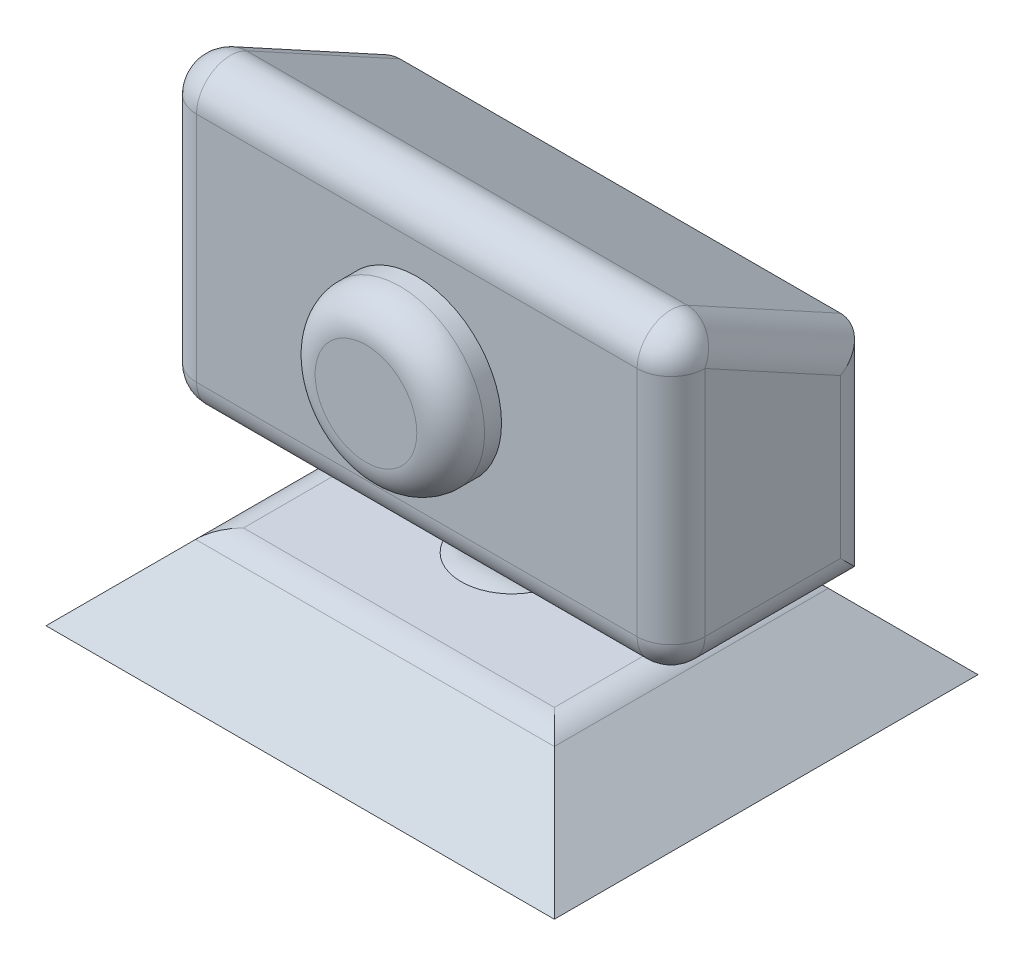
from build123d import *

# Parameters (mm, degrees)
SKETCH1_W           = 30
SKETCH1_H           = 25
BOSS_EXTRUDE1_DEPTH = 5
CHAMFER1_SIZE       = 5
BOSS_EXTRUDE4_DEPTH = 15
FILLET3_R           = 2
FILLET4_R           = 2
SKETCH12_R          = 5
BOSS_EXTRUDE5_DEPTH = 3
FILLET5_R           = 2


with BuildPart() as part:
    # Sketch1 → Boss-Extrude1 (new body)
    with BuildSketch(Plane(origin=(0, 0, 0), x_dir=(1, 0, 0), z_dir=(0, 1, 0))):
        Rectangle(SKETCH1_W, SKETCH1_H)
    extrude(amount=BOSS_EXTRUDE1_DEPTH)

    # Chamfer1
    chamfer1_edges = [part.edges().sort_by_distance(p)[0] for p in [
        (0, 5, 12.5),
        (-15, 5, 0),
        (0, 5, -12.5),
        (15, 5, 0),
    ]]
    chamfer(chamfer1_edges, length=CHAMFER1_SIZE - 0.0001)  # a hair under: the kernel refuses the full size

    # Sketch9 → Revolve1 (revolve)
    with BuildSketch(Plane.XY):
        with BuildLine():
            Line((0, 5), (0, 8))
            Line((0, 8), (3, 8))
            ThreePointArc((3, 8), (2.378679656, 6.5), (3, 5))
            Line((3, 5), (0, 5))
        make_face()
    revolve(axis=Axis((0, 5, 0), (0, 1, 0)))

    # Sketch11 → Boss-Extrude4 (add, symmetric)
    with BuildSketch(Plane(origin=(0, 0, 0), x_dir=(0, 0, -1), z_dir=(1, 0, 0))):
        Polygon((-5.616779032, 27.075000452), (6.383220968, 20.532496755), (6.383220968, 8), (-5.616779032, 8), align=None)
    extrude(amount=BOSS_EXTRUDE4_DEPTH, both=True)

    # Fillet3
    fillet3_edges = [part.edges().sort_by_distance(p)[0] for p in [
        (-15, 14.266248378, -6.383220968),
        (-15, 23.803748604, -0.383220968),
        (-15, 17.537500226, 5.616779032),
        (0, 27.075000452, 5.616779032),
        (-15, 8, -0.383220968),
        (0, 8, 5.616779032),
        (15, 14.266248378, -6.383220968),
        (15, 23.803748604, -0.383220968),
        (15, 17.537500226, 5.616779032),
        (15, 8, -0.383220968),
    ]]
    fillet(fillet3_edges, radius=FILLET3_R)

    # Fillet4
    fillet4_edges = [part.edges().sort_by_distance(p)[0] for p in [
        (10.0001, 5, 0),
        (0, 5, -7.5001),
        (-10.0001, 5, 0),
        (0, 5, 7.5001),
    ]]
    fillet(fillet4_edges, radius=FILLET4_R)

    # Sketch12 → Boss-Extrude5 (add)
    with BuildSketch(Plane.XY.offset(5.616779032)):
        with Locations(Location((0, 16.913633245, 0), (0, 0, 90))):
            Circle(SKETCH12_R)
    extrude(amount=BOSS_EXTRUDE5_DEPTH)

    # Fillet5
    fillet5_edges = [part.edges().sort_by_distance(p)[0] for p in [
        (0, 11.913633245, 8.616779032),
    ]]
    fillet(fillet5_edges, radius=FILLET5_R)


solid = part.part
